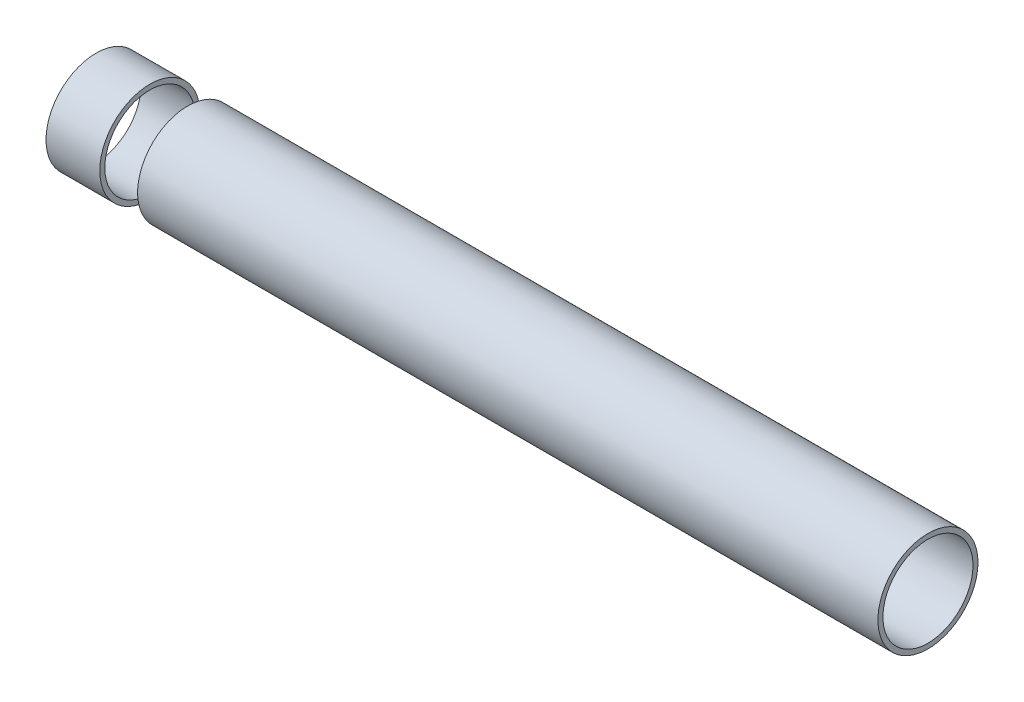
from build123d import *

# Parameters (mm, degrees)
SKETCH1_R               = 15.875
SKETCH1_R_2             = 14.2875
EXTRUDE_THIN1_DEPTH     = 131.955749997
CUT_EXTRUDE1_DEPTH      = 134.851974985
CUT_EXTRUDE1_DEPTH_BACK = 134.851974985
SKETCH2_W               = 11.999999876
SKETCH2_H               = 31.75


with BuildPart() as part:
    # Sketch1 → Extrude-Thin1 (new, symmetric)
    with BuildSketch(Plane(origin=(0, 0, 0), x_dir=(0, 0, -1), z_dir=(1, 0, 0))):
        Circle(SKETCH1_R)
        Circle(SKETCH1_R_2, mode=Mode.SUBTRACT)
    extrude(amount=EXTRUDE_THIN1_DEPTH, both=True)

    # Sketch2 → Cut-Extrude1 (cut, two sides: drawn at the far end of the back side and taken through both)
    with BuildSketch(Plane(origin=(0, 0, 0), x_dir=(1, 0, 0), z_dir=(0, 1, 0)).offset(-CUT_EXTRUDE1_DEPTH_BACK)):
        with Locations((-108.895300055, 0)):
            Rectangle(SKETCH2_W, SKETCH2_H)
    extrude(amount=CUT_EXTRUDE1_DEPTH + CUT_EXTRUDE1_DEPTH_BACK, mode=Mode.SUBTRACT)


with BuildPart() as cut_extrude1_piece_1:
    # of the separate pieces the step leaves, piece 1, a body of its own (cut_extrude1_pieces)
    add(part.part.solids().sort_by_distance((-102.895300117, 0, -15.875))[0])


with BuildPart() as cut_extrude1_piece_2:
    # of the separate pieces the step leaves, piece 2, a body of its own (cut_extrude1_pieces)
    add(part.part.solids().sort_by_distance((-131.955749997, 0, -15.875))[0])


solid = Compound([cut_extrude1_piece_1.part, cut_extrude1_piece_2.part])
